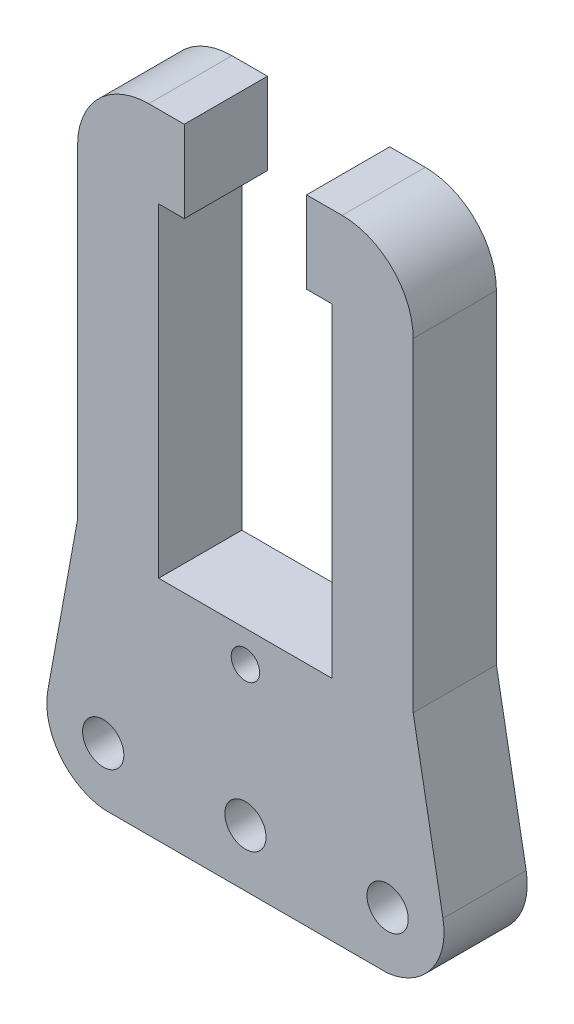
from build123d import *

# Parameters (mm, degrees)
MODEL_R             = 1.45
MODEL_R_2           = 1
BOSS_EXTRUDE1_DEPTH = 5.85


with BuildPart() as part:
    # Model → Boss-Extrude1 (new body)
    with BuildSketch(Plane.XY):
        with BuildLine():
            Line((508.182236888, 554.934833401), (506.087301785, 543.461595882))
            ThreePointArc((506.087301785, 543.461595882), (506.893587564, 539.980874482), (509.982236888, 538.184833401))
            Line((509.982236888, 538.184833401), (529.982236888, 538.184833401))
            ThreePointArc((529.982236888, 538.184833401), (533.070886212, 539.980874482), (533.877171991, 543.461595882))
            Line((533.877171991, 543.461595882), (531.782236888, 554.934833401))
            Line((531.782236888, 554.934833401), (531.782236888, 577.734833401))
            ThreePointArc((531.782236888, 577.734833401), (530.317770794, 581.270367307), (526.782236888, 582.734833401))
            Line((526.782236888, 582.734833401), (524.282236888, 582.734833401))
            Line((524.282236888, 582.734833401), (524.282236888, 576.984833401))
            Line((524.282236888, 576.984833401), (526.082236888, 576.984833401))
            Line((526.082236888, 576.984833401), (526.082236888, 554.184833401))
            Line((526.082236888, 554.184833401), (513.882236888, 554.184833401))
            Line((513.882236888, 554.184833401), (513.882236888, 576.984833401))
            Line((513.882236888, 576.984833401), (515.682236888, 576.984833401))
            Line((515.682236888, 576.984833401), (515.682236888, 582.734833401))
            Line((515.682236888, 582.734833401), (513.182236888, 582.734833401))
            ThreePointArc((513.182236888, 582.734833401), (509.646702982, 581.270367307), (508.182236888, 577.734833401))
            Line((508.182236888, 577.734833401), (508.182236888, 554.934833401))
        make_face()
        with Locations((509.982236888, 542.184833401)):
            Circle(MODEL_R, mode=Mode.SUBTRACT)
        with Locations((519.982236888, 542.184833401)):
            Circle(MODEL_R, mode=Mode.SUBTRACT)
        with Locations((529.982236888, 542.184833401)):
            Circle(MODEL_R, mode=Mode.SUBTRACT)
        with Locations((519.982236888, 551.984833401)):
            Circle(MODEL_R_2, mode=Mode.SUBTRACT)
    extrude(amount=BOSS_EXTRUDE1_DEPTH)


solid = part.part
